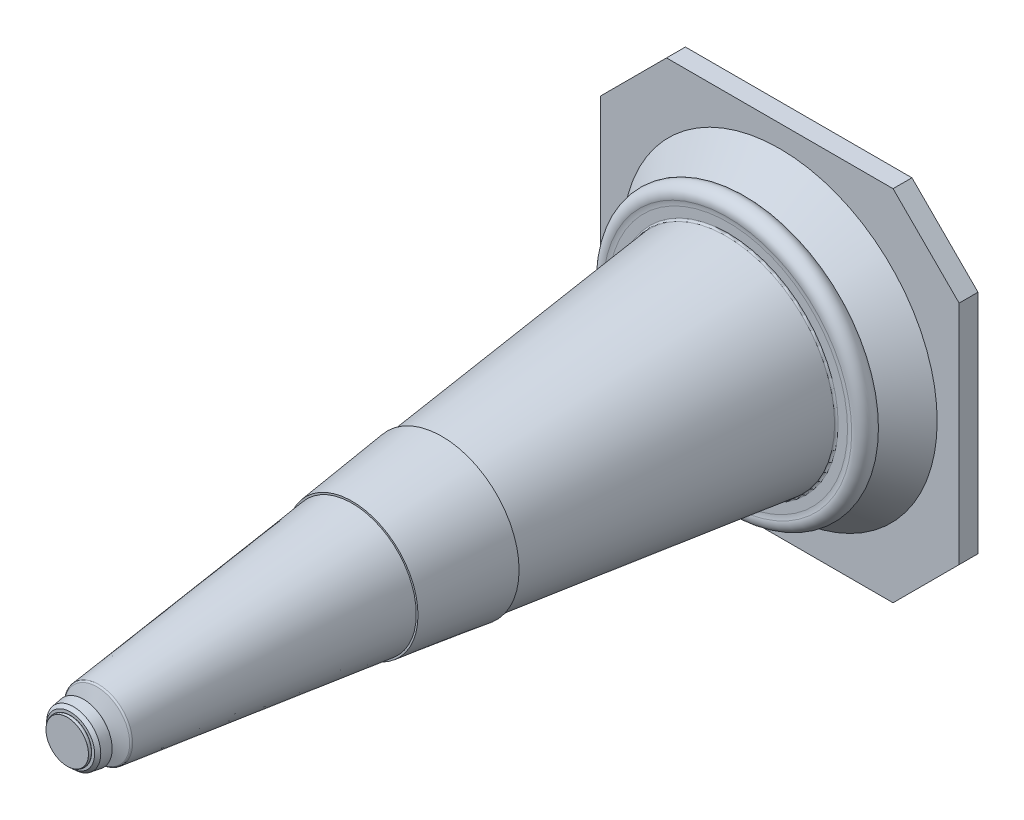
from build123d import *

# Parameters (mm, degrees)
BOSS_EXTRUDE2_START = -55
BOSS_EXTRUDE2_DEPTH = 20
SKETCH3_R           = 130
CUT_EXTRUDE1_DEPTH  = 20
SKETCH9_R           = 162.75
CUT_EXTRUDE3_DEPTH  = 20


# Read off the part's stored shape, not the designer's step: Loft3
with BuildPart() as part:
    # Sketch1 → Boss-Extrude2 (new body)
    with BuildSketch(Plane.XY.offset(BOSS_EXTRUDE2_START)):
        Polygon((-190, -120), (-120, -190), (120, -190), (190, -120), (190, 120), (120, 190), (-120, 190), (-190, 120), align=None)
    extrude(amount=BOSS_EXTRUDE2_DEPTH)

    # Sketch3 → Cut-Extrude1 (cut)
    with BuildSketch(Plane.XY.offset(-35)):
        Circle(SKETCH3_R)
    extrude(amount=-CUT_EXTRUDE1_DEPTH, mode=Mode.SUBTRACT)

    # Sketch9 → Cut-Extrude3 (cut)
    with BuildSketch(Plane(origin=(0, 0, -55), x_dir=(-1, 0, 0), z_dir=(0, 0, -1))):
        Circle(SKETCH9_R)
    extrude(amount=-CUT_EXTRUDE3_DEPTH, mode=Mode.SUBTRACT)


with BuildPart() as body_2:
    # Loft3 outline → Loft3 (revolve)
    with BuildSketch(Plane.XZ):
        Polygon((0, 0), (0, -35), (166.75, -35), (130, 0), align=None)
    revolve(axis=Axis((0, 0, 0), (0, 0, 1)))

    # Sketch8 → Cut-Revolve1 (revolve, cut)
    with BuildSketch(Plane(origin=(0, 0, 0), x_dir=(0, 0, -1), z_dir=(1, 0, 0)), mode=Mode.PRIVATE) as cut_revolve1_sk:
        Polygon((0, 0), (35, 0), (35, 162.75), (0, 126), align=None)
    revolve(cut_revolve1_sk.sketch.rotate(Axis((0, 0, 0), (0, 0, -1)), 90), axis=Axis((0, 0, 0), (0, 0, -1)), mode=Mode.SUBTRACT)

    # Sketch18 → Revolve4 (revolve)
    with BuildSketch(Plane(origin=(0, 0, 0), x_dir=(0, 0, -1), z_dir=(1, 0, 0)), mode=Mode.PRIVATE) as revolve4_sk:
        with BuildLine():
            Line((-717, 0), (-717, 19.880896372))
            Line((-717, 19.880896372), (-711.430063707, 25.939956583))
            Line((-711.430063707, 25.939956583), (-704.149994744, 27.048103663))
            Line((-704.149994744, 27.048103663), (-702.591028043, 24.575678841))
            Line((-702.591028043, 24.575678841), (-697.908954114, 15.920764941))
            ThreePointArc((-697.908954114, 15.920764941), (-693.904332922, 13.853697296), (-690.5171686, 16.826385876))
            Line((-690.5171686, 16.826385876), (-685.686718887, 33.078167753))
            Line((-685.686718887, 33.078167753), (-415, 65.159223247))
            Line((-415, 65.159223247), (-415, 67.038663474))
            Line((-415, 67.038663474), (-326, 78.375118354))
            Line((-326, 78.375118354), (-326, 75.707261772))
            Line((-326, 75.707261772), (-21.365526799, 111.811713001))
            ThreePointArc((-21.365526799, 111.811713001), (-18.216191925, 113.455994535), (-16.953994733, 116.776962792))
            Line((-16.953994733, 116.776962792), (-16.953994733, 126.721209442))
            ThreePointArc((-16.953994733, 126.721209442), (-17.116390345, 129.56610105), (-17.601467394, 132.374032825))
            ThreePointArc((-17.601467394, 132.374032825), (-10.170275435, 141.99702029), (-2.220359419, 132.79792593))
            ThreePointArc((-2.220359419, 132.79792593), (-1.122705538, 128.720419572), (2.705021128, 126.937329357))
            Line((2.705021128, 126.937329357), (13, 126.937329357))
            ThreePointArc((13, 126.937329357), (16.535533906, 128.401795451), (18, 131.937329357))
            Line((18, 131.937329357), (18, 137.5))
            ThreePointArc((18, 137.5), (22.5, 142), (27, 137.5))
            Line((27, 137.5), (30, 137.5))
            ThreePointArc((30, 137.5), (22.5, 145), (15, 137.5))
            Line((15, 137.5), (15, 131.937329357))
            ThreePointArc((15, 131.937329357), (14.414213562, 130.523115794), (13, 129.937329357))
            Line((13, 129.937329357), (2.705021128, 129.937329357))
            ThreePointArc((2.705021128, 129.937329357), (1.173930462, 130.650565443), (0.734868909, 132.281567986))
            ThreePointArc((0.734868909, 132.281567986), (-10.252922059, 144.995881663), (-20.523770674, 131.695694019))
            ThreePointArc((-20.523770674, 131.695694019), (-20.096902871, 129.224714057), (-19.953994733, 126.721209442))
            Line((-19.953994733, 126.721209442), (-19.953994733, 116.776962792))
            ThreePointArc((-19.953994733, 116.776962792), (-20.45887361, 115.448575489), (-21.71860756, 114.790862876))
            Line((-21.71860756, 114.790862876), (-323, 79.083809681))
            Line((-323, 79.083809681), (-323, 81.781485054))
            Line((-323, 81.781485054), (-418, 69.680774789))
            Line((-418, 69.680774789), (-418, 67.824667435))
            Line((-418, 67.824667435), (-686.693199765, 35.979878418))
            ThreePointArc((-686.693199765, 35.979878418), (-687.746135964, 35.523557207), (-688.374922713, 34.563593191))
            Line((-688.374922713, 34.563593191), (-693.41383333, 17.61045609))
            ThreePointArc((-693.41383333, 17.61045609), (-694.250887422, 16.833841296), (-695.27031196, 17.348198856))
            Line((-695.27031196, 17.348198856), (-700, 26.091128461))
            Line((-700, 26.091128461), (-702.659848871, 30.309484353))
            Line((-702.659848871, 30.309484353), (-713.151234858, 28.712521631))
            Line((-713.151234858, 28.712521631), (-720, 22.5))
            Line((-720, 22.5), (-720, 0))
            Line((-720, 0), (-717, 0))
        make_face()
    revolve(revolve4_sk.sketch.rotate(Axis((0, 0, 720), (0, 0, -1)), 90), axis=Axis((0, 0, 720), (0, 0, -1)))

    # Sketch19 → Cut-Revolve2 (revolve, cut)
    with BuildSketch(Plane(origin=(0, 0, 0), x_dir=(0, 0, -1), z_dir=(1, 0, 0)), mode=Mode.PRIVATE) as cut_revolve2_sk:
        with BuildLine():
            ThreePointArc((-719.825479408, 22.658307802), (-718.169996579, 23.20634511), (-716.575617429, 22.5))
            Line((-716.575617429, 22.5), (-716.575617429, 25.606260816))
            Line((-716.575617429, 25.606260816), (-719.825479408, 22.658307802))
        make_face()
    revolve(cut_revolve2_sk.sketch.rotate(Axis((0, 0, 720), (0, 0, -1)), 90), axis=Axis((0, 0, 720), (0, 0, -1)), mode=Mode.SUBTRACT)


solid = Compound([part.part, body_2.part])
